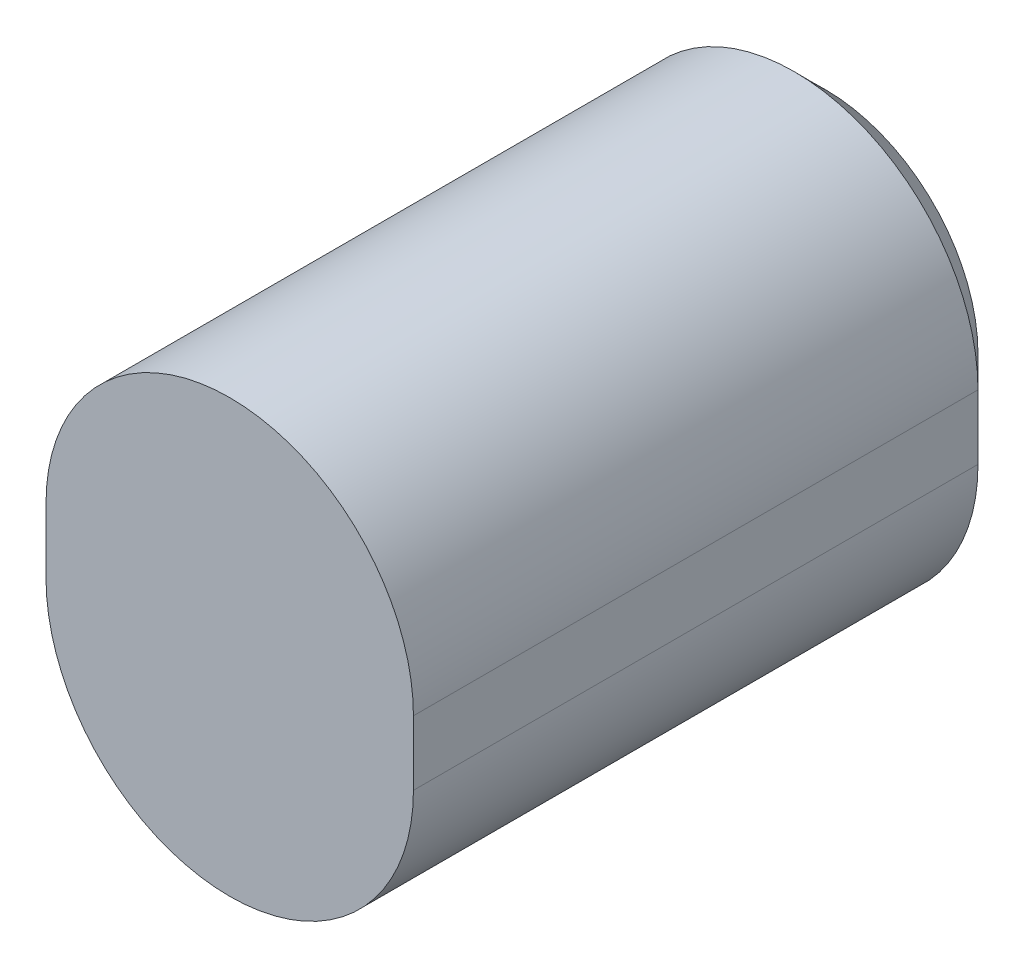
from build123d import *

# Parameters (mm, degrees)
BOSS_EXTRUDE1_DEPTH = 190.5
CHAMFER1_SIZE       = 10


with BuildPart() as part:
    # Sketch1 → Boss-Extrude1 (new body)
    with BuildSketch(Plane.XY):
        with BuildLine():
            Line((-58.7375, -10.31875), (-58.7375, 10.31875))
            ThreePointArc((-58.7375, 10.31875), (0, 69.05625), (58.7375, 10.31875))
            Line((58.7375, 10.31875), (58.7375, -10.31875))
            ThreePointArc((58.7375, -10.31875), (0, -69.05625), (-58.7375, -10.31875))
        make_face()
    extrude(amount=BOSS_EXTRUDE1_DEPTH)

    # Chamfer1
    chamfer1_edges = [part.edges().sort_by_distance(p)[0] for p in [
        (0, -69.05625, 0),
        (58.7375, 0, 0),
        (-58.7375, 0, 0),
        (0, 69.05625, 0),
    ]]
    chamfer(chamfer1_edges, length=CHAMFER1_SIZE)


solid = part.part
